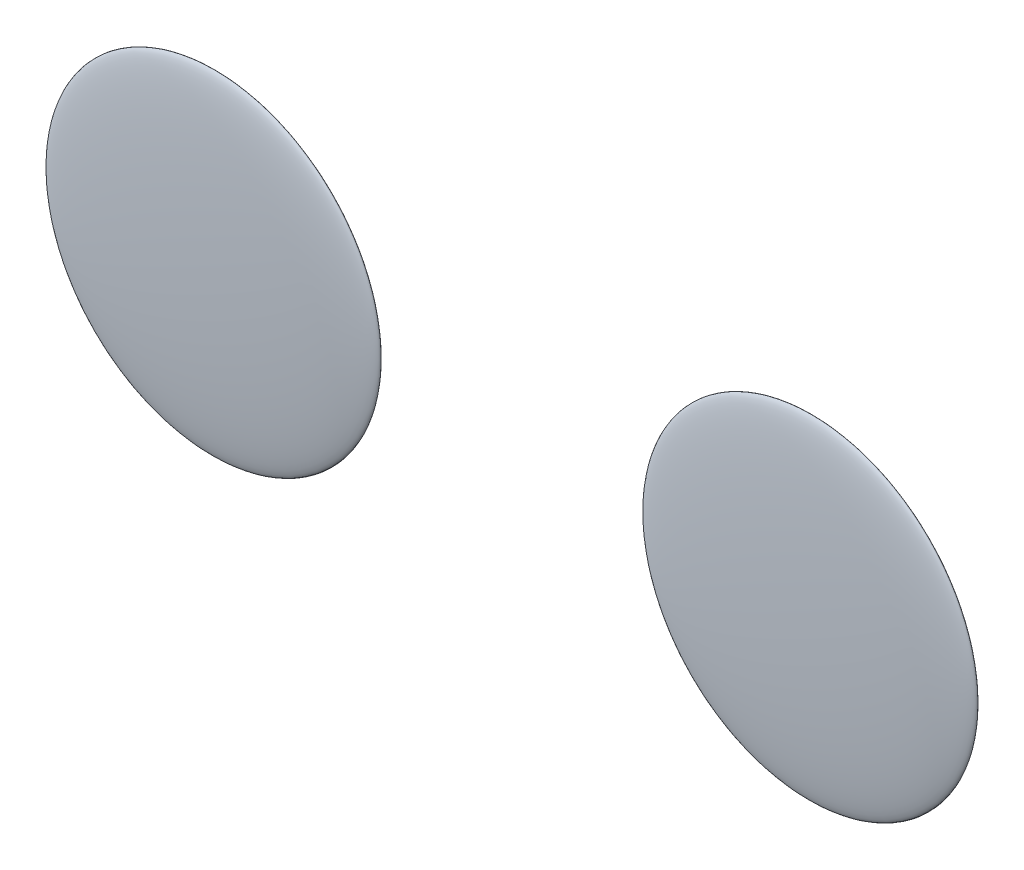
from build123d import *
from build123d.topology import SkipClean


# Read off the part's stored shape, not the designer's step: PCB Surface
with BuildPart() as part:
    # Sketch8 → Revolve18 (revolve)
    with SkipClean():  # the faces are left unmerged after this step: merging them gives an invalid solid
        with BuildSketch(Plane(origin=(0, 10.449285824, 0), x_dir=(1, 0, 0), z_dir=(0, 1, 0))):
            with BuildLine():
                add(Edge.make_bspline(
                    [(6.0325, 0.35), (6.0325, 0.0198), (10.4775, 0.0198)],
                    knots=[0, 0, 0, 1.570796327, 1.570796327, 1.570796327], degree=2, weights=[1, 0.707106781, 1]))
                Line((10.4775, 0.0198), (10.4775, 0.6802))
                add(Edge.make_bspline(
                    [(10.4775, 0.6802), (6.0325, 0.6802), (6.0325, 0.35)],
                    knots=[4.71238898, 4.71238898, 4.71238898, 6.283185307, 6.283185307, 6.283185307], degree=2, weights=[1, 0.707106781, 1]))
            make_face()
            with BuildLine():
                Line((10.4775, 0.6802), (10.4775, 0.0198))
                add(Edge.make_bspline(
                    [(10.4775, 0.0198), (14.9225, 0.0198), (14.9225, 0.35), (14.9225, 0.6802), (10.4775, 0.6802)],
                    knots=[1.570796327, 1.570796327, 1.570796327, 3.141592654, 3.141592654, 4.71238898, 4.71238898, 4.71238898], degree=2, weights=[1, 0.707106781, 1, 0.707106781, 1]))
            make_face()
        revolve(axis=Axis((10.4775, 10.449285824, -0.0198), (0, 0, -1)))
    add(part.part.scale(1), mode=Mode.REPLACE)  # the faces are merged on a copy


with BuildPart() as body_2:
    # Sketch9 → Revolve19 (revolve)
    with SkipClean():  # the faces are left unmerged after this step: merging them gives an invalid solid
        with BuildSketch(Plane(origin=(0, 10.449285824, 0), x_dir=(1, 0, 0), z_dir=(0, 1, 0))):
            with BuildLine():
                add(Edge.make_bspline(
                    [(21.9075, 0.35), (21.9075, 0.0198), (26.3525, 0.0198)],
                    knots=[0, 0, 0, 1.570796327, 1.570796327, 1.570796327], degree=2, weights=[1, 0.707106781, 1]))
                Line((26.3525, 0.0198), (26.3525, 0.6802))
                add(Edge.make_bspline(
                    [(26.3525, 0.6802), (21.9075, 0.6802), (21.9075, 0.35)],
                    knots=[4.71238898, 4.71238898, 4.71238898, 6.283185307, 6.283185307, 6.283185307], degree=2, weights=[1, 0.707106781, 1]))
            make_face()
            with BuildLine():
                Line((26.3525, 0.6802), (26.3525, 0.0198))
                add(Edge.make_bspline(
                    [(26.3525, 0.0198), (30.7975, 0.0198), (30.7975, 0.35), (30.7975, 0.6802), (26.3525, 0.6802)],
                    knots=[1.570796327, 1.570796327, 1.570796327, 3.141592654, 3.141592654, 4.71238898, 4.71238898, 4.71238898], degree=2, weights=[1, 0.707106781, 1, 0.707106781, 1]))
            make_face()
        revolve(axis=Axis((26.3525, 10.449285824, -0.0198), (0, 0, -1)))
    add(body_2.part.scale(1), mode=Mode.REPLACE)  # the faces are merged on a copy


solid = Compound([part.part, body_2.part])
